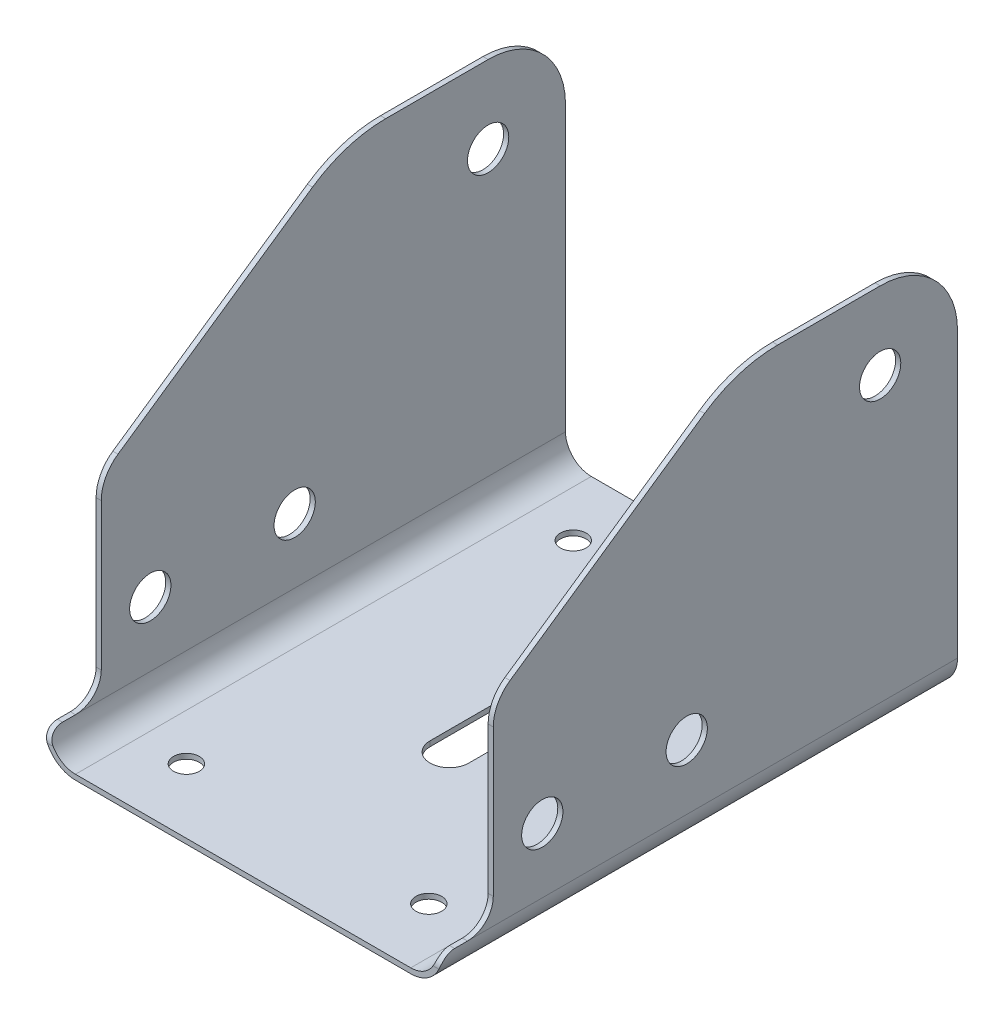
from build123d import *

# Parameters (mm, degrees)
SKETCH1_W                      = 150
SKETCH1_H                      = 200
BASE_FLANGE1_DEPTH             = 2
EDGE_FLANGE1_STRIP_W           = 28
EDGE_FLANGE1_STRIP_H           = 2
EDGE_FLANGE1_STRIP_CUT_DEPTH   = 200
EDGE_FLANGE1_STRIP_2_W         = 28
EDGE_FLANGE1_STRIP_2_H         = 2
EDGE_FLANGE1_STRIP_CUT_2_DEPTH = 200
EDGE_FLANGE1_DEPTH             = 200
EDGE_FLANGE1_BEND_DEPTH        = 200
SKETCH15_OUTSIDE_W             = 260.93
SKETCH15_OUTSIDE_H             = 212.93
SKETCH15_OUTSIDE_R             = 8
CUT_EXTRUDE1_DEPTH             = 238.099135384
SKETCH16_R                     = 5
CUT_EXTRUDE2_DEPTH             = 197.033160551


# Sheet-metal steps are written as plain solids
with BuildPart() as part:
    # Sketch1 → Base-Flange1 (new body)
    with BuildSketch(Plane(origin=(0, 0, 0), x_dir=(1, 0, 0), z_dir=(0, 1, 0))):
        Rectangle(SKETCH1_W, SKETCH1_H)
    extrude(amount=-BASE_FLANGE1_DEPTH)

    # Edge-Flange1 strip (across the edge) → Edge-Flange1 strip cut (cut)
    with BuildSketch(Plane(origin=(75, 0, 100), x_dir=(-1, 0, 0), z_dir=(0, 0, -1))):
        with Locations((-4, -1)):
            Rectangle(EDGE_FLANGE1_STRIP_W, EDGE_FLANGE1_STRIP_H)
    extrude(amount=EDGE_FLANGE1_STRIP_CUT_DEPTH, mode=Mode.SUBTRACT)

    # Edge-Flange1 strip 2 (across the edge) → Edge-Flange1 strip cut 2 (cut)
    with BuildSketch(Plane(origin=(-75, 0, -100), x_dir=(1, 0, 0), z_dir=(0, 0, 1))):
        with Locations((-4, -1)):
            Rectangle(EDGE_FLANGE1_STRIP_2_W, EDGE_FLANGE1_STRIP_2_H)
    extrude(amount=EDGE_FLANGE1_STRIP_CUT_2_DEPTH, mode=Mode.SUBTRACT)

    # Edge-Flange1 section (across the edge) → Edge-Flange1 (add)
    with BuildSketch(Plane(origin=(75, 0, 100), x_dir=(-1, 0, 0), z_dir=(0, 0, -1))):
        with BuildLine():
            Line((-2, 10), (-2, 150))
            Line((-2, 150), (0, 150))
            Line((0, 150), (0, 10))
            ThreePointArc((0, 10), (2.928932188, 2.928932188), (10, 0))
            Line((10, 0), (10, -2))
            ThreePointArc((10, -2), (1.514718626, 1.514718626), (-2, 10))
        make_face()
    extrude(amount=EDGE_FLANGE1_DEPTH)

    # Edge-Flange1 section 2 (across the edge) → Edge-Flange1 bend (add)
    with BuildSketch(Plane(origin=(-75, 0, -100), x_dir=(1, 0, 0), z_dir=(0, 0, 1))):
        with BuildLine():
            Line((-2, 10), (-2, 150))
            Line((-2, 150), (0, 150))
            Line((0, 150), (0, 10))
            ThreePointArc((0, 10), (2.928932188, 2.928932188), (10, 0))
            Line((10, 0), (10, -2))
            ThreePointArc((10, -2), (1.514718626, 1.514718626), (-2, 10))
        make_face()
    extrude(amount=EDGE_FLANGE1_BEND_DEPTH)

    # Sketch15 outside → Cut-Extrude1 (cut, through all)
    # profile 1 of 4: a face of its own
    with BuildSketch(Plane.ZY.offset(77)):
        with Locations((0, 74)):
            Rectangle(SKETCH15_OUTSIDE_W, SKETCH15_OUTSIDE_H)
        with BuildLine():
            Line((-1.916529607, 141.180744276), (73.507242037, 89.243178795))
            ThreePointArc((73.507242037, 89.243178795), (78.277963521, 83.867184852), (80, 76.888955512))
            Line((80, 76.888955512), (80, 20))
            ThreePointArc((80, 20), (82.928932188, 12.928932188), (90, 10))
            Line((90, 10), (95, 10))
            ThreePointArc((95, 10), (98.535533906, 8.535533906), (100, 5))
            Line((100, 5), (100, -2))
            Line((100, -2), (-100, -2))
            Line((-100, -2), (-100, 99))
            Line((-100, 99), (-100, 120))
            ThreePointArc((-100, 120), (-91.213203436, 141.213203436), (-70, 150))
            Line((-70, 150), (-49, 150))
            Line((-49, 150), (-30.274003064, 150))
            ThreePointArc((-30.274003064, 150), (-15.425387199, 147.744304445), (-1.916529607, 141.180744276))
        make_face(mode=Mode.SUBTRACT)
    # profile 2 of 4: a face of its own
    with BuildSketch(Plane.ZY.offset(77)):
        with Locations(Location((61, 35, 0), (0, 0, 270))):
            Circle(SKETCH15_OUTSIDE_R)
    # profile 3 of 4: a face of its own
    with BuildSketch(Plane.ZY.offset(77)):
        with Locations(Location((-70, 120, 0), (0, 0, 270))):
            Circle(SKETCH15_OUTSIDE_R)
    # profile 4 of 4: a face of its own
    with BuildSketch(Plane.ZY.offset(77)):
        with Locations(Location((5, 35, 0), (0, 0, 270))):
            Circle(SKETCH15_OUTSIDE_R)
    extrude(amount=-CUT_EXTRUDE1_DEPTH, mode=Mode.SUBTRACT)

    # Sketch16 → Cut-Extrude2 (cut, through all)
    with BuildSketch(Plane(origin=(0, 0, 0), x_dir=(1, 0, 0), z_dir=(0, 1, 0))):
        with Locations(Location((-47, 75, 0), (0, 0, 270))):
            Circle(SKETCH16_R)
        with Locations(Location((47, 75, 0), (0, 0, 90))):
            Circle(SKETCH16_R)
        with Locations(Location((47, -75, 0), (0, 0, 270))):
            Circle(SKETCH16_R)
        with Locations(Location((-47, -75, 0), (0, 0, 90))):
            Circle(SKETCH16_R)
        with BuildLine():
            Line((7.5, 20), (7.5, -20))
            ThreePointArc((7.5, -20), (0, -27.5), (-7.5, -20))
            Line((-7.5, -20), (-7.5, 20))
            ThreePointArc((-7.5, 20), (0, 27.5), (7.5, 20))
        make_face()
    extrude(amount=-CUT_EXTRUDE2_DEPTH, mode=Mode.SUBTRACT)


solid = part.part
